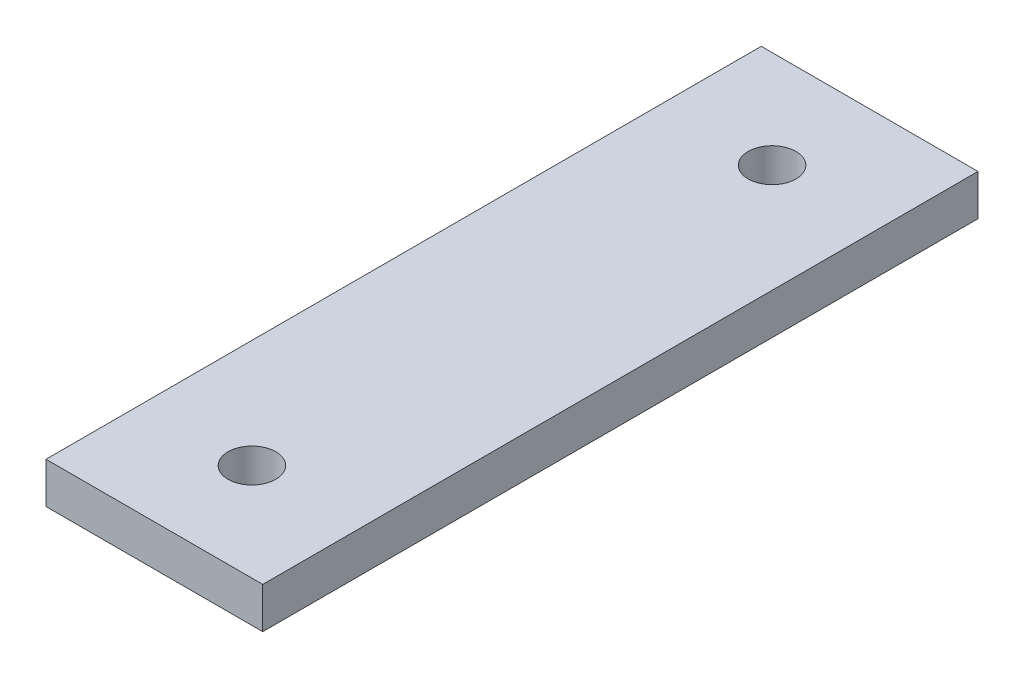
from build123d import *

# Parameters (mm, degrees)
SKETCH1_W           = 31.75
SKETCH1_H           = 104.775
BOSS_EXTRUDE1_DEPTH = 6
SKETCH2_R           = 3.5
CUT_EXTRUDE1_DEPTH  = 83.237176052


with BuildPart() as part:
    # Sketch1 → Boss-Extrude1 (new body)
    with BuildSketch(Plane(origin=(0, 0, 0), x_dir=(1, 0, 0), z_dir=(0, 1, 0))):
        with Locations((3.175, -27.3875)):
            Rectangle(SKETCH1_W, SKETCH1_H)
    extrude(amount=BOSS_EXTRUDE1_DEPTH)

    # Sketch2 → Cut-Extrude1 (cut, through all)
    with BuildSketch(Plane(origin=(0, 6, 0), x_dir=(1, 0, 0), z_dir=(0, 1, 0))):
        with Locations((3.175, 10.7125)):
            Circle(SKETCH2_R)
        with Locations((3.175, -65.4875)):
            Circle(SKETCH2_R)
    extrude(amount=-CUT_EXTRUDE1_DEPTH, mode=Mode.SUBTRACT)


solid = part.part
